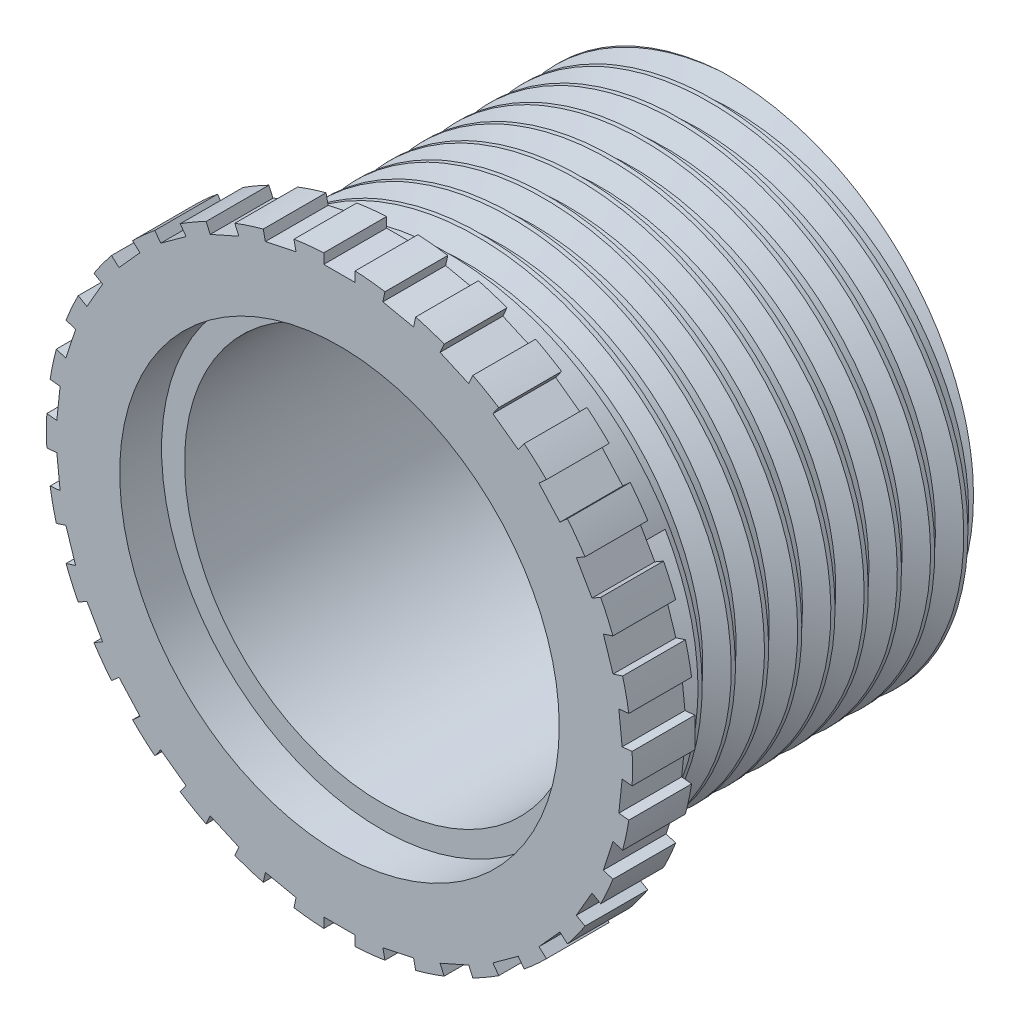
from build123d import *

# Parameters (mm, degrees)
ESQUISSE1_R             = 6
BOSS_EXTRU_1_DEPTH      = 8
ESQUISSE2_R             = 5
ENL_V_MAT_EXTRU_1_DEPTH = 8
BOSS_EXTRU_2_START      = 1.5
ESQUISSE3_R             = 7
ESQUISSE3_R_2           = 5
BOSS_EXTRU_2_DEPTH      = 1.5
ESQUISSE4_W             = 0.75
ESQUISSE4_H             = 0.5
ENL_V_MAT_EXTRU_2_DEPTH = 1.5
BOSS_EXTRU_3_START      = -0.5
ESQUISSE5_R             = 5
ESQUISSE5_R_2           = 4.7
BOSS_EXTRU_3_DEPTH      = 9
FILETAGE1_PITCH         = 0.79375
ESQUISSE6_R             = 5.25
ENL_V_MAT_EXTRU_3_DEPTH = 1


with BuildPart() as part:
    # Esquisse1 → Boss.-Extru.1 (new body)
    with BuildSketch(Plane.XY):
        Circle(ESQUISSE1_R)
    extrude(amount=BOSS_EXTRU_1_DEPTH)

    # Esquisse2 → Enlèv. mat.-Extru.1 (cut)
    with BuildSketch(Plane.XY.offset(8)):
        Circle(ESQUISSE2_R)
    extrude(amount=-ENL_V_MAT_EXTRU_1_DEPTH, mode=Mode.SUBTRACT)

    # Esquisse3 → Boss.-Extru.2 (add)
    with BuildSketch(Plane.XY.offset(8).offset(BOSS_EXTRU_2_START)):
        Circle(ESQUISSE3_R)
        Circle(ESQUISSE3_R_2, mode=Mode.SUBTRACT)
    extrude(amount=-BOSS_EXTRU_2_DEPTH)

    # Esquisse4 → Enlèv. mat.-Extru.2 (cut)
    with BuildSketch(Plane.XY.offset(9.5)):
        Polygon((1.140554408, 7.169536989), (1.036598563, 6.680463189), (1.770209263, 6.524529421), (1.874165109, 7.013603221), align=None)
        with Locations((0, 7)):
            Rectangle(ESQUISSE4_W, ESQUISSE4_H)
        Polygon((2.606261116, 6.775730809), (2.402892794, 6.31895808), (3.088051887, 6.013905598), (3.291420209, 6.470678327), align=None)
        Polygon((3.958061706, 6.085792679), (3.66416908, 5.681284182), (4.270931826, 5.240445242), (4.564824452, 5.64495374), align=None)
        Polygon((5.136876007, 5.129876206), (4.765303595, 4.795310902), (5.267151549, 4.237952283), (5.638723962, 4.572517587), align=None)
        Polygon((6.091184177, 3.949759526), (5.658171476, 3.699759526), (6.033171476, 3.050240474), (6.466184177, 3.300240474), align=None)
        Polygon((6.77927837, 2.597019403), (6.303750112, 2.442510906), (6.535512858, 1.729218518), (7.011041116, 1.883727016), align=None)
        Polygon((7.171085568, 1.130777069), (6.67382462, 1.078512838), (6.752220967, 0.332621416), (7.249481915, 0.384885648), align=None)
        Polygon((7.249481915, -0.384885648), (6.752220967, -0.332621416), (6.67382462, -1.078512838), (7.171085568, -1.130777069), align=None)
        Polygon((7.011041116, -1.883727016), (6.535512858, -1.729218518), (6.303750112, -2.442510906), (6.77927837, -2.597019403), align=None)
        Polygon((6.466184177, -3.300240474), (6.033171476, -3.050240474), (5.658171476, -3.699759526), (6.091184177, -3.949759526), align=None)
        Polygon((5.638723962, -4.572517587), (5.267151549, -4.237952283), (4.765303595, -4.795310902), (5.136876007, -5.129876206), align=None)
        Polygon((4.564824452, -5.64495374), (4.270931826, -5.240445242), (3.66416908, -5.681284182), (3.958061706, -6.085792679), align=None)
        Polygon((3.291420209, -6.470678327), (3.088051887, -6.013905598), (2.402892794, -6.31895808), (2.606261116, -6.775730809), align=None)
        Polygon((1.874165109, -7.013603221), (1.770209263, -6.524529421), (1.036598563, -6.680463189), (1.140554408, -7.169536989), align=None)
        with Locations((0, -7)):
            Rectangle(ESQUISSE4_W, ESQUISSE4_H)
        Polygon((-1.140554408, -7.169536989), (-1.036598563, -6.680463189), (-1.770209263, -6.524529421), (-1.874165109, -7.013603221), align=None)
        Polygon((-2.606261116, -6.775730809), (-2.402892794, -6.31895808), (-3.088051887, -6.013905598), (-3.291420209, -6.470678327), align=None)
        Polygon((-3.958061706, -6.085792679), (-3.66416908, -5.681284182), (-4.270931826, -5.240445242), (-4.564824452, -5.64495374), align=None)
        Polygon((-5.136876007, -5.129876206), (-4.765303595, -4.795310902), (-5.267151549, -4.237952283), (-5.638723962, -4.572517587), align=None)
        Polygon((-6.091184177, -3.949759526), (-5.658171476, -3.699759526), (-6.033171476, -3.050240474), (-6.466184177, -3.300240474), align=None)
        Polygon((-6.77927837, -2.597019403), (-6.303750112, -2.442510906), (-6.535512858, -1.729218518), (-7.011041116, -1.883727016), align=None)
        Polygon((-7.171085568, -1.130777069), (-6.67382462, -1.078512838), (-6.752220967, -0.332621416), (-7.249481915, -0.384885648), align=None)
        Polygon((-7.249481915, 0.384885648), (-6.752220967, 0.332621416), (-6.67382462, 1.078512838), (-7.171085568, 1.130777069), align=None)
        Polygon((-7.011041116, 1.883727016), (-6.535512858, 1.729218518), (-6.303750112, 2.442510906), (-6.77927837, 2.597019403), align=None)
        Polygon((-6.466184177, 3.300240474), (-6.033171476, 3.050240474), (-5.658171476, 3.699759526), (-6.091184177, 3.949759526), align=None)
        Polygon((-5.638723962, 4.572517587), (-5.267151549, 4.237952283), (-4.765303595, 4.795310902), (-5.136876007, 5.129876206), align=None)
        Polygon((-4.564824452, 5.64495374), (-4.270931826, 5.240445242), (-3.66416908, 5.681284182), (-3.958061706, 6.085792679), align=None)
        Polygon((-3.291420209, 6.470678327), (-3.088051887, 6.013905598), (-2.402892794, 6.31895808), (-2.606261116, 6.775730809), align=None)
        Polygon((-1.874165109, 7.013603221), (-1.770209263, 6.524529421), (-1.036598563, 6.680463189), (-1.140554408, 7.169536989), align=None)
    extrude(amount=-ENL_V_MAT_EXTRU_2_DEPTH, mode=Mode.SUBTRACT)

    # Esquisse5 → Boss.-Extru.3 (add)
    with BuildSketch(Plane.XY.offset(9.5).offset(BOSS_EXTRU_3_START)):
        Circle(ESQUISSE5_R)
        Circle(ESQUISSE5_R_2, mode=Mode.SUBTRACT)
    extrude(amount=-BOSS_EXTRU_3_DEPTH)

    # Filetage1: the profile of Profil de filetage1 profile screwed along a right-hand helix of 10.07874 turns, 8 arcs to a turn; built about Z, then put on its axis
    filetage1_z = Axis((0, 0, 0), (0, 0, 1))
    filetage1_corners = [(6.0003, 0, -0.000173205), (6.0003, 0, 0.694704453), (5.570370212, 0, 0.446484374), (5.570370212, 0, 0.248046874)]
    with BuildLine(mode=Mode.PRIVATE) as filetage1_profile:
        Line(filetage1_corners[0], filetage1_corners[1])
        Line(filetage1_corners[1], filetage1_corners[2])
        Line(filetage1_corners[2], filetage1_corners[3])
        Line(filetage1_corners[3], filetage1_corners[0])
    filetage1_cap = Face(filetage1_profile.wire())
    filetage1_turn_angles = [0, 22.5, 45, 67.5, 90, 112.5, 135, 157.5, 180, 202.5, 225, 247.5, 270, 292.5, 315, 337.5, 360]
    filetage1_turn_weights = [1, 0.9238795325112867, 1, 0.9238795325112867, 1, 0.9238795325112867, 1, 0.9238795325112867, 1, 0.9238795325112867, 1, 0.9238795325112867, 1, 0.9238795325112867, 1, 0.9238795325112867, 1]
    filetage1_turn_rails = [Edge.make_bspline([Vector(p[0], p[1], 0).rotate(filetage1_z, filetage1_turn_angles[k]) / filetage1_turn_weights[k] + Vector(0, 0, p[2] + FILETAGE1_PITCH * filetage1_turn_angles[k] / 360) for k in range(17)], [0, 0, 0, 1, 1, 2, 2, 3, 3, 4, 4, 5, 5, 6, 6, 7, 7, 8, 8, 8], 2, filetage1_turn_weights) for p in filetage1_corners]
    filetage1_turn_sides = [Face.make_surface_from_curves(filetage1_turn_rails[p[0]], filetage1_turn_rails[p[1]]) for p in [(0, 1), (1, 2), (2, 3), (3, 0)]]
    filetage1_last_angles = [3600, 3614.173228346, 3628.346456693]
    filetage1_last_weights = [1, 0.9695598647982457, 1]
    filetage1_last_rails = [Edge.make_bspline([Vector(p[0], p[1], 0).rotate(filetage1_z, filetage1_last_angles[k]) / filetage1_last_weights[k] + Vector(0, 0, p[2] + FILETAGE1_PITCH * filetage1_last_angles[k] / 360) for k in range(3)], [0, 0, 0, 1, 1, 1], 2, filetage1_last_weights) for p in filetage1_corners]
    filetage1_last_sides = [Face.make_surface_from_curves(filetage1_last_rails[p[0]], filetage1_last_rails[p[1]]) for p in [(0, 1), (1, 2), (2, 3), (3, 0)]]
    filetage1 = Plane(origin=(0, 0, -1), x_dir=(1, 0, 0), z_dir=(0, 0, 1)) * Solid(Shell([*[p.moved(Location((0, 0, FILETAGE1_PITCH * i))) for i in range(10) for p in filetage1_turn_sides], *filetage1_last_sides, filetage1_cap, filetage1_cap.rotate(filetage1_z, 3628.346456693).moved(Location((0, 0, FILETAGE1_PITCH * 3628.346456693 / 360)))]))
    add(filetage1, mode=Mode.SUBTRACT)

    # Esquisse6 → Enlèv. mat.-Extru.3 (cut)
    with BuildSketch(Plane.XY.offset(9.5)):
        Circle(ESQUISSE6_R)
    extrude(amount=-ENL_V_MAT_EXTRU_3_DEPTH, mode=Mode.SUBTRACT)


solid = part.part
